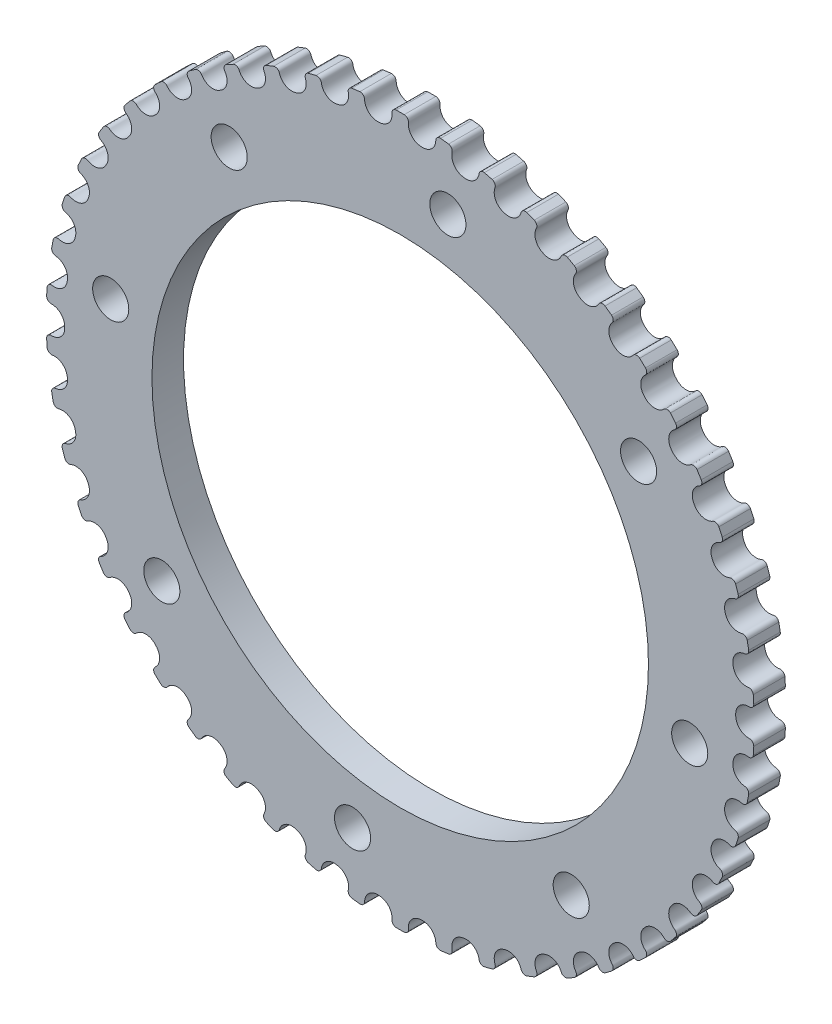
from build123d import *

# Parameters (mm, degrees)
SKETCHREVOLVEGEARBELT01_W       = 3.5
SKETCHREVOLVEGEARBELT01_H       = 39.217218411
TOOTHEXTRUDECUTGEARBELT01_DEPTH = 7.238999891
PATTERNGEARBELT01_COUNT         = 50
BOREREVOLVESKETCH_W             = 14.477999782
BOREREVOLVESKETCH_H             = 27.5
SKETCH1_R                       = 2
CUT_EXTRUDE1_DEPTH              = 10


with BuildPart() as part:
    # SketchRevolveGearBelt01 → GearBelt01 (revolve)
    with BuildSketch(Plane(origin=(0, 0, 0), x_dir=(0, 0, -1), z_dir=(1, 0, 0))):
        with Locations((0, 19.608609206)):
            Rectangle(SKETCHREVOLVEGEARBELT01_W, SKETCHREVOLVEGEARBELT01_H)
    revolve(axis=Axis((0, 0, 0), (0, 0, -1)))

    # SketchToothGearBelt01 → ToothExtrudeCutGearBelt01 (cut, symmetric)
    with BuildSketch(Plane.XY):
        with BuildLine():
            ThreePointArc((39.164679022, 2.032334243), (39.217374535, 0), (39.164679022, -2.032334243))
            add(Edge.make_bspline(
                [(39.164679022, -2.032334243), (39.166048883, -2.005984565), (39.164883295, -1.966294001), (39.156943231, -1.91408071), (39.147835553, -1.875531869), (39.135634795, -1.83784758), (39.12042125, -1.801275572), (39.102294908, -1.766056265), (39.081374934, -1.732421187), (39.057798852, -1.700591449), (39.031721649, -1.670776298), (39.003314752, -1.64317173), (38.972764904, -1.617959231), (38.940272938, -1.59530448), (38.906052449, -1.575356646), (38.870328405, -1.558245974), (38.833335623, -1.544088262), (38.795317397, -1.532964211), (38.756523252, -1.524993116), (38.717209712, -1.520055082), (38.66580266, -1.5184582), (38.589994052, -1.519756698), (38.489697952, -1.516042965), (38.377509936, -1.502613699), (38.266707897, -1.480535762), (38.157982142, -1.449806634), (38.052000418, -1.410652745), (37.949416183, -1.363305357), (37.850861265, -1.308058822), (37.756942857, -1.245252774), (37.668239537, -1.175274325), (37.585297771, -1.098554529), (37.50862852, -1.015566038), (37.43870413, -0.926820101), (37.375955295, -0.832863447), (37.320768875, -0.73427489), (37.27348376, -0.631661826), (37.234395318, -0.525656278), (37.203729181, -0.416911781), (37.181730901, -0.306096466), (37.168324647, -0.193899714), (37.165224472, -0.105119728), (37.165512565, -0.040500395), (37.16545238, 0), (37.165512565, 0.040500395), (37.165224472, 0.105119728), (37.168324647, 0.193899714), (37.181730901, 0.306096466), (37.203729181, 0.416911781), (37.234395318, 0.525656278), (37.27348376, 0.631661826), (37.320768875, 0.73427489), (37.375955295, 0.832863447), (37.43870413, 0.926820101), (37.50862852, 1.015566038), (37.585297771, 1.098554529), (37.668239537, 1.175274325), (37.756942857, 1.245252774), (37.850861265, 1.308058822), (37.949416183, 1.363305357), (38.052000418, 1.410652745), (38.157982142, 1.449806634), (38.266707897, 1.480535762), (38.377509936, 1.502613699), (38.489697952, 1.516042965), (38.589994052, 1.519756698), (38.66580266, 1.5184582), (38.717209712, 1.520055082), (38.756523252, 1.524993116), (38.795317397, 1.532964211), (38.833335623, 1.544088262), (38.870328405, 1.558245974), (38.906052449, 1.575356646), (38.940272938, 1.59530448), (38.972764904, 1.617959231), (39.003314752, 1.64317173), (39.031721649, 1.670776298), (39.057798852, 1.700591449), (39.081374934, 1.732421187), (39.102294908, 1.766056265), (39.12042125, 1.801275572), (39.135634795, 1.83784758), (39.147835553, 1.875531869), (39.156943231, 1.91408071), (39.164883295, 1.966294001), (39.166048883, 2.005984565), (39.164679022, 2.032334243)],
                knots=[0, 0, 0, 0, 0.012346399, 0.018519598, 0.024692797, 0.030865997, 0.037039196, 0.043212395, 0.049385595, 0.055558794, 0.061731993, 0.067905193, 0.074078392, 0.080251591, 0.086424791, 0.09259799, 0.09877119, 0.104944389, 0.111117588, 0.117290788, 0.123463987, 0.135171051, 0.152780618, 0.170390185, 0.187999752, 0.205609319, 0.223218886, 0.240828453, 0.25843802, 0.276047587, 0.293657154, 0.311266721, 0.328876288, 0.346485855, 0.364095422, 0.381704989, 0.399314555, 0.416924122, 0.434533689, 0.452143256, 0.469752823, 0.48736239, 0.493681195, 0.5, 0.506318805, 0.51263761, 0.530247177, 0.547856744, 0.565466311, 0.583075878, 0.600685445, 0.618295011, 0.635904578, 0.653514145, 0.671123712, 0.688733279, 0.706342846, 0.723952413, 0.74156198, 0.759171547, 0.776781114, 0.794390681, 0.812000248, 0.829609815, 0.847219382, 0.864828949, 0.876536013, 0.882709212, 0.888882412, 0.895055611, 0.90122881, 0.90740201, 0.913575209, 0.919748409, 0.925921608, 0.932094807, 0.938268007, 0.944441206, 0.950614405, 0.956787605, 0.962960804, 0.969134003, 0.975307203, 0.981480402, 0.987653601, 1, 1, 1, 1], degree=3))
        make_face()
    toothextrudecutgearbelt01 = extrude(amount=TOOTHEXTRUDECUTGEARBELT01_DEPTH, both=True, mode=Mode.SUBTRACT)

    # PatternGearBelt01: ToothExtrudeCutGearBelt01 ×50 about axis
    patterngearbelt01_axis = Axis((0, 0, 55), (0, 0, -1))
    for i in range(1, PATTERNGEARBELT01_COUNT):
        add(toothextrudecutgearbelt01.rotate(patterngearbelt01_axis, i * 360 / PATTERNGEARBELT01_COUNT), mode=Mode.SUBTRACT)

    # BoreRevolveSketch → BoreRevolveCut (revolve, cut)
    with BuildSketch(Plane(origin=(0, 0, 0), x_dir=(0, 0, -1), z_dir=(1, 0, 0))):
        with Locations((0, 13.75)):
            Rectangle(BOREREVOLVESKETCH_W, BOREREVOLVESKETCH_H)
    revolve(axis=Axis((0, 0, 0), (0, 0, -1)), mode=Mode.SUBTRACT)

    # Sketch1 → Cut-Extrude1 (cut)
    with BuildSketch(Plane.XY.offset(1.75)):
        with Locations((5.27873993, 32.068440947)):
            Circle(SKETCH1_R)
        with Locations((26.408444856, 18.943179255)):
            Circle(SKETCH1_R)
        with Locations((32.068440947, -5.27873993)):
            Circle(SKETCH1_R)
        with Locations((18.943179255, -26.408444856)):
            Circle(SKETCH1_R)
        with Locations((-5.27873993, -32.068440947)):
            Circle(SKETCH1_R)
        with Locations((-26.408444856, -18.943179255)):
            Circle(SKETCH1_R)
        with Locations((-32.068440947, 5.27873993)):
            Circle(SKETCH1_R)
        with Locations((-18.943179255, 26.408444856)):
            Circle(SKETCH1_R)
    extrude(amount=-CUT_EXTRUDE1_DEPTH, mode=Mode.SUBTRACT)


solid = part.part
